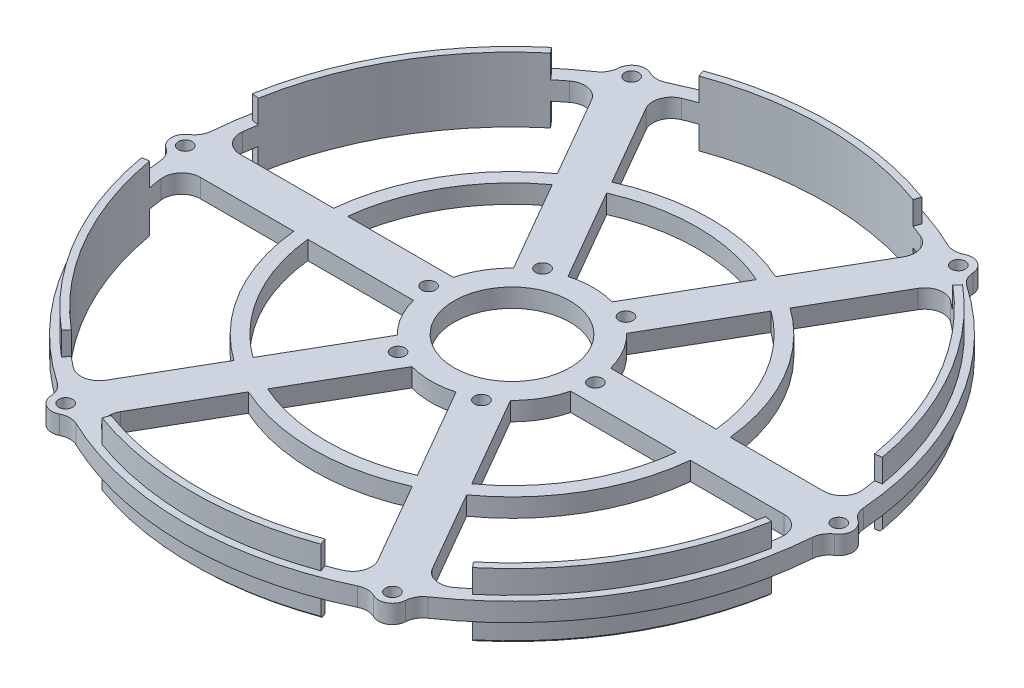
from build123d import *
from build123d.topology import SkipClean

# Parameters (mm, degrees)
SKETCH_1_R           = 1.4999999999999996
SKETCH_1_R_2         = 1.4999999999999998
SKETCH_1_R_3         = 1.5
SKETCH_1_R_4         = 1.4999999999999993
SKETCH_1_R_5         = 1.4999999999999971
SKETCH_1_R_6         = 1.5000000000000007
SKETCH_1_R_7         = 1.4999999999999944
SKETCH_1_R_8         = 1.4999999999999918
SKETCH_1_R_9         = 1.4999999999999887
SKETCH_1_R_10        = 4.5
EXTRUDE_1_DEPTH      = 4
FILLET_1_R           = 4
FILLET_2_R           = 4
EXTRUDE_2_DEPTH      = 5
EXTRUDE_2_DEPTH_BACK = 9
CHAMFER_1_SIZE       = 0.5
SKETCH_3_R           = 43
SKETCH_3_R_2         = 40
EXTRUDE_3_DEPTH      = 4
SKETCH_4_R           = 12.5
CUT_EXTRUDE_1_DEPTH  = 10
SKETCH_5_R           = 17.500000000000004
SKETCH_5_R_2         = 12.5
EXTRUDE_4_DEPTH      = 4
SKETCH_6_R           = 1.4999999999999987
SKETCH_6_R_2         = 1.4999999999997233
SKETCH_6_R_3         = 1.500000000000449
SKETCH_6_R_4         = 1.500000000001465
SKETCH_6_R_5         = 1.5000000000018021
SKETCH_6_R_6         = 1.5000000000011438
CUT_EXTRUDE_2_DEPTH  = 9.000000000000002


with BuildPart() as part:
    # 草图1 → 凸台-拉伸1 (new body)
    with BuildSketch(Plane(origin=(0, 0, 0), x_dir=(1, 0, 0), z_dir=(0, 1, 0))):
        with BuildLine():
            ThreePointArc((-70.5, 3.000000000000008), (-73.50000000000001, 3.7e-16), (-70.5, -3.000000000000008))
            ThreePointArc((-70.5, -3.000000000000008), (-61.11004418260574, -35.281900459016875), (-37.84807621135403, -59.55479096680248))
            ThreePointArc((-37.84807621135403, -59.55479096680248), (-36.75000000000076, -63.65286717815582), (-32.65192378864741, -62.55479096680256))
            ThreePointArc((-32.65192378864741, -62.55479096680256), (-7.3209e-13, -70.56380091803446), (32.65192378864611, -62.55479096680326))
            ThreePointArc((32.65192378864611, -62.55479096680326), (36.74999999999942, -63.65286717815661), (37.848076211352776, -59.5547909668033))
            ThreePointArc((37.848076211352776, -59.5547909668033), (61.110044182605264, -35.281900459017756), (70.49999999999999, -3.0000000000005))
            ThreePointArc((70.49999999999999, -3.0000000000005), (73.50000000000001, -5.1362e-13), (70.50000000000003, 2.9999999999995155))
            ThreePointArc((70.50000000000003, 2.9999999999995155), (61.11004418260573, 35.28190045901688), (37.84807621135361, 59.55479096680278))
            ThreePointArc((37.84807621135361, 59.55479096680278), (36.75000000000032, 63.65286717815611), (32.65192378864698, 62.55479096680282))
            ThreePointArc((32.65192378864698, 62.55479096680282), (2.3935e-13, 70.5638009180345), (-32.65192378864655, 62.55479096680301))
            ThreePointArc((-32.65192378864655, 62.55479096680301), (-36.74999999999988, 63.65286717815634), (-37.84807621135321, 59.55479096680301))
            ThreePointArc((-37.84807621135321, 59.55479096680301), (-61.110044182605506, 35.281900459017315), (-70.5, 3.000000000000008))
        make_face()
        with Locations(Location((-8, 0, 0), (0, 0, 270))):
            Circle(SKETCH_1_R, mode=Mode.SUBTRACT)
        with Locations(Location((2.793e-14, 8, 0), (0, 0, 270))):
            Circle(SKETCH_1_R_2, mode=Mode.SUBTRACT)
        with Locations(Location((8, -5.586e-14, 0), (0, 0, 270))):
            Circle(SKETCH_1_R_3, mode=Mode.SUBTRACT)
        with Locations(Location((-8.38e-14, -7.999999999999998, 0), (0, 0, 270))):
            Circle(SKETCH_1_R_4, mode=Mode.SUBTRACT)
        with Locations(Location((-70.5, 0, 0), (0, 0, 270))):
            Circle(SKETCH_1_R_5, mode=Mode.SUBTRACT)
        with Locations(Location((-35.24999999999988, 61.05479096680301, 0), (0, 0, 270))):
            Circle(SKETCH_1_R_5, mode=Mode.SUBTRACT)
        with Locations(Location((35.2500000000003, 61.0547909668028, 0), (0, 0, 270))):
            Circle(SKETCH_1_R_6, mode=Mode.SUBTRACT)
        with Locations(Location((70.5, -4.923e-13, 0), (0, 0, 270))):
            Circle(SKETCH_1_R_7, mode=Mode.SUBTRACT)
        with Locations(Location((35.24999999999944, -61.05479096680328, 0), (0, 0, 270))):
            Circle(SKETCH_1_R_8, mode=Mode.SUBTRACT)
        with Locations(Location((-35.25000000000072, -61.054790966802514, 0), (0, 0, 270))):
            Circle(SKETCH_1_R_9, mode=Mode.SUBTRACT)
        with Locations(Location((0, 0, 0), (0, 0, 270))):
            Circle(SKETCH_1_R_10, mode=Mode.SUBTRACT)
        with BuildLine():
            Line((9.579036496304996, 4.300239505243507), (67.36288251105015, 4.300239505243303))
            ThreePointArc((67.36288251105015, 4.300239505243303), (58.45671475544981, 33.74999999999966), (37.40555790942386, 56.187847774093825))
            Line((37.40555790942386, 56.187847774093825), (8.513634902050875, 6.145569196956556))
            ThreePointArc((8.513634902050875, 6.145569196956556), (9.093266739736636, 5.249999999999946), (9.579036496304996, 4.300239505243507))
        make_face(mode=Mode.SUBTRACT)
        with BuildLine():
            Line((8.513634902050788, -6.145569196956676), (37.405557909423074, -56.18784777409434))
            ThreePointArc((37.405557909423074, -56.18784777409434), (58.45671475544934, -33.7500000000005), (67.36288251105009, -4.300239505244269))
            Line((67.36288251105009, -4.300239505244269), (9.579036496304743, -4.3002395052440665))
            ThreePointArc((9.579036496304743, -4.3002395052440665), (9.093266739736448, -5.250000000000277), (8.513634902050788, -6.145569196956676))
        make_face(mode=Mode.SUBTRACT)
        with BuildLine():
            Line((-37.405557909423486, 56.187847774094074), (-8.513634902051102, 6.145569196956236))
            ThreePointArc((-8.513634902051102, 6.145569196956236), (-9.093266739736535, 5.250000000000124), (-9.579036496304667, 4.3002395052442415))
            Line((-9.579036496304667, 4.3002395052442415), (-67.36288251105003, 4.300239505244943))
            ThreePointArc((-67.36288251105003, 4.300239505244943), (-58.45671475544931, 33.75000000000055), (-37.405557909423486, 56.187847774094074))
        make_face(mode=Mode.SUBTRACT)
        with BuildLine():
            Line((-1.0654015942542432, -10.44580870220016), (-29.957324601627235, -60.48808727933743))
            ThreePointArc((-29.957324601627235, -60.48808727933743), (-7.1529e-13, -67.50000000000001), (29.957324601625945, -60.48808727933805))
            Line((29.957324601625945, -60.48808727933805), (1.0654015942535602, -10.445808702200226))
            ThreePointArc((1.0654015942535602, -10.445808702200226), (-3.4441e-13, -10.500000000000004), (-1.0654015942542432, -10.44580870220016))
        make_face(mode=Mode.SUBTRACT)
        with BuildLine():
            Line((29.957324601626794, 60.48808727933765), (1.065401594253708, 10.445808702200214))
            ThreePointArc((1.065401594253708, 10.445808702200214), (-1.952e-13, 10.500000000000004), (-1.065401594254097, 10.44580870220017))
            Line((-1.065401594254097, 10.44580870220017), (-29.957324601626386, 60.48808727933784))
            ThreePointArc((-29.957324601626386, 60.48808727933784), (2.1397e-13, 67.50000000000003), (29.957324601626794, 60.48808727933765))
        make_face(mode=Mode.SUBTRACT)
        with BuildLine():
            Line((-9.579036496304774, -4.300239505243998), (-67.36288251105012, -4.300239505243795))
            ThreePointArc((-67.36288251105012, -4.300239505243795), (-58.45671475544982, -33.749999999999666), (-37.405557909424274, -56.18784777409356))
            Line((-37.405557909424274, -56.18784777409356), (-8.513634902051185, -6.145569196956118))
            ThreePointArc((-8.513634902051185, -6.145569196956118), (-9.093266739736634, -5.249999999999946), (-9.579036496304774, -4.300239505243998))
        make_face(mode=Mode.SUBTRACT)
    extrude(amount=EXTRUDE_1_DEPTH)

    # 圆角1
    fillet_1_edges = [part.edges().sort_by_distance(p)[0] for p in [
        (-32.651923788646556, 2, -62.554790966803),
        (32.65192378864698, 2, -62.55479096680281),
        (37.848076211353614, 2, -59.55479096680278),
        (70.50000000000003, 2, -2.9999999999995124),
        (70.49999999999997, 2, 3.000000000000502),
        (37.848076211352776, 2, 59.554790966803296),
        (32.651923788646116, 2, 62.55479096680326),
        (-32.65192378864741, 2, 62.55479096680256),
        (-37.84807621135403, 2, 59.55479096680247),
        (-70.5, 2, 3.0000000000000093),
        (-70.50000000000001, 2, -3.000000000000006),
        (-37.84807621135322, 2, -59.55479096680301),
        (29.957324601625942, 2, 60.488087279338046),
        (-29.957324601627235, 2, 60.488087279337435),
        (67.36288251105009, 2, 4.30023950524427),
        (37.40555790942307, 2, 56.18784777409434),
        (37.40555790942386, 2, -56.187847774093825),
        (67.36288251105015, 2, -4.300239505243303),
        (-29.957324601626386, 2, -60.48808727933785),
        (29.957324601626794, 2, -60.488087279337655),
        (-67.36288251105003, 2, -4.300239505244943),
        (-37.40555790942349, 2, -56.18784777409407),
        (-67.36288251105012, 2, 4.300239505243796),
        (-37.405557909424274, 2, 56.18784777409357),
    ]]
    fillet(fillet_1_edges, radius=FILLET_1_R)

    # 圆角2
    # the kernel refuses this fillet: 4 mm, written as the material it adds along each edge
    with BuildSketch(Plane(origin=(-1.0654015942542432, 0, 10.44580870220016), x_dir=(-0.5000000000000071, 0, 0.8660254037844346), z_dir=(0, 1, 0))) as fillet_2_piece_1:
        with BuildLine():
            CenterArc((2.3102874607430097, 4.000000000000001), FILLET_2_R, 214.9198731811867, 55.08012681881331)
            ThreePointArc((-0.9695260446492189, 1.710278757174414), (-0.44464689566161064, 0.8778804840632212), (0, 0))
            Line((0, 0), (2.31028746074301, 1e-17))
        make_face()
    extrude(amount=4)
    with BuildSketch(Plane(origin=(-8.513634902051187, 0, 6.145569196956119), x_dir=(-0.5068146140540679, 0, -0.8620550718957729), z_dir=(0, 1, 0))) as fillet_2_piece_2:
        with BuildLine():
            CenterArc((2.3404393067669487, 3.9824329250590425), FILLET_2_R, 209.5481152574792, 55.08012681882752)
            Line((-1.1393281601452958, 2.0098157862763673), (0, 0))
            ThreePointArc((0, 0), (0.9829845088421205, 0.04611357172001613), (1.9659690176842453, -4e-17))
        make_face()
    extrude(amount=4)
    with BuildSketch(Plane(origin=(-9.579036496304774, 0, 4.300239505243998), x_dir=(-1, 0, -3.46e-15), z_dir=(0, 1, 0))) as fillet_2_piece_3:
        with BuildLine():
            CenterArc((2.310287460742878, 4), FILLET_2_R, 214.91987318118893, 55.08012681881104)
            ThreePointArc((-0.9695260446492592, 1.7102787571742841), (-0.44464689566163024, 0.877880484063158), (0, 0))
            Line((0, 0), (2.3102874607428774, 0))
        make_face()
    extrude(amount=4)
    with BuildSketch(Plane(origin=(-9.579036496304667, 0, -4.300239505244241), x_dir=(0.49315428469593503, 0, -0.86994186672791), z_dir=(0, 1, 0))) as fillet_2_piece_4:
        with BuildLine():
            CenterArc((2.340439306766931, 3.982432925059041), FILLET_2_R, 209.54811525747962, 55.08012681882701)
            Line((-1.1393281601452994, 2.0098157862763424), (0, 0))
            ThreePointArc((0, 0), (0.9829845088421114, 0.04611357172001763), (1.9659690176842226, 1e-16))
        make_face()
    extrude(amount=4)
    with BuildSketch(Plane(origin=(-8.513634902051102, 0, -6.145569196956236), x_dir=(-0.4999999999999958, 0, -0.866025403784441), z_dir=(0, 1, 0))) as fillet_2_piece_5:
        with BuildLine():
            CenterArc((2.310287460742879, 3.9999999999999996), FILLET_2_R, 214.91987318118888, 55.080126818811095)
            ThreePointArc((-0.9695260446492604, 1.7102787571742883), (-0.4446468956616306, 0.8778804840631608), (0, 0))
            Line((0, 0), (2.3102874607428756, 0))
        make_face()
    extrude(amount=4)
    with BuildSketch(Plane(origin=(1.0654015942537083, 0, -10.445808702200214), x_dir=(0.5000000000000073, 0, -0.8660254037844344), z_dir=(0, 1, 0))) as fillet_2_piece_6:
        with BuildLine():
            CenterArc((2.3102874607428614, 4), FILLET_2_R, 214.91987318118936, 55.08012681881064)
            ThreePointArc((-0.9695260446492604, 1.710278757174261), (-0.4446468956616301, 0.8778804840631479), (0, 0))
            Line((0, 0), (2.3102874607428623, 1e-17))
        make_face()
    extrude(amount=4)
    with BuildSketch(Plane(origin=(-1.065401594254097, 0, -10.445808702200168), x_dir=(0.9999688987499935, 0, -0.007886794832196306), z_dir=(0, 1, 0))) as fillet_2_piece_7:
        with BuildLine():
            CenterArc((2.34043930676708, 3.9824329250590376), FILLET_2_R, 209.5481152574761, 55.08012681882997)
            Line((-1.13932816014527, 2.0098157862765516), (0, 0))
            ThreePointArc((0, 0), (0.9829845088421648, 0.04611357172002539), (1.96596901768433, 0))
        make_face()
    extrude(amount=4)
    with BuildSketch(Plane(origin=(9.579036496304997, 0, -4.300239505243507), x_dir=(-0.4931542846958736, 0, -0.8699418667279448), z_dir=(0, 1, 0))) as fillet_2_piece_8:
        with BuildLine():
            CenterArc((2.340439306767078, -3.9824329250590407), FILLET_2_R, 95.37175792369351, 55.08012681882957)
            Line((-1.1393281601452454, -2.009815786276506), (0, 0))
            ThreePointArc((0, 0), (0.9829845088421809, -0.04611357172001845), (1.9659690176843594, 3e-17))
        make_face()
    extrude(amount=4)
    with BuildSketch(Plane(origin=(8.513634902050875, 0, -6.145569196956556), x_dir=(0.5000000000000061, 0, -0.866025403784435), z_dir=(0, 1, 0))) as fillet_2_piece_9:
        with BuildLine():
            CenterArc((2.310287460742994, -4.000000000000001), FILLET_2_R, 89.99999999999994, 55.08012681881351)
            ThreePointArc((-0.9695260446492374, -1.7102787571744216), (-0.4446468956616173, -0.8778804840632259), (0, 0))
            Line((0, 0), (2.310287460742998, 0))
        make_face()
    extrude(amount=4)
    with BuildSketch(Plane(origin=(9.579036496304745, 0, 4.3002395052440665), x_dir=(-0.49315428469592015, 0, 0.8699418667279183), z_dir=(0, 1, 0))) as fillet_2_piece_10:
        with BuildLine():
            CenterArc((2.3404393067669487, 3.9824329250590416), FILLET_2_R, 209.54811525747917, 55.08012681882752)
            Line((-1.1393281601452967, 2.0098157862763704), (0, 0))
            ThreePointArc((0, 0), (0.9829845088421224, 0.04611357172001689), (1.9659690176842455, -5e-17))
        make_face()
    extrude(amount=4)
    with BuildSketch(Plane(origin=(8.51363490205079, 0, 6.145569196956677), x_dir=(0.4999999999999941, 0, 0.866025403784442), z_dir=(0, 1, 0))) as fillet_2_piece_11:
        with BuildLine():
            CenterArc((2.310287460742971, 4), FILLET_2_R, 214.9198731811868, 55.080126818813255)
            ThreePointArc((-0.969526044649251, 1.7102787571744063), (-0.44464689566161575, 0.8778804840632242), (0, 0))
            Line((0, 0), (2.3102874607429755, 0))
        make_face()
    extrude(amount=4)
    with BuildSketch(Plane(origin=(1.0654015942535602, 0, 10.445808702200228), x_dir=(0.4999999999999959, 0, 0.8660254037844409), z_dir=(0, 1, 0))) as fillet_2_piece_12:
        with BuildLine():
            CenterArc((2.3102874607428734, -4), FILLET_2_R, 89.99999999999994, 55.08012681881101)
            ThreePointArc((-0.9695260446492603, -1.7102787571742772), (-0.4446468956616315, -0.8778804840631549), (0, 0))
            Line((0, 0), (2.3102874607428774, -2.2e-16))
        make_face()
    extrude(amount=4)

    # 草图2 → 凸台-拉伸2 (add, two sides: drawn at the far end of the back side and taken through both)
    with SkipClean():  # the faces are left unmerged after this step: merging them gives an invalid solid
        with BuildSketch(Plane(origin=(0, 0, 0), x_dir=(-1, 0, 0), z_dir=(0, -1, 0)).offset(-EXTRUDE_2_DEPTH_BACK)):
            with BuildLine():
                Line((23.0863596744827, -63.429251903048794), (23.5993898894712, -64.83879083422764))
                ThreePointArc((23.5993898894712, -64.83879083422764), (4.23e-15, -68.99999999999999), (-23.5993898894712, -64.83879083422764))
                Line((-23.5993898894712, -64.83879083422764), (-23.0863596744827, -63.429251903048794))
                ThreePointArc((-23.0863596744827, -63.429251903048794), (4.13e-15, -67.5), (23.0863596744827, -63.429251903048794))
            make_face()
            with BuildLine():
                Line((-43.38816365384148, -51.70799991053096), (-44.352345068371285, -52.85706657520941))
                ThreePointArc((-44.352345068371285, -52.85706657520941), (-59.75575286112633, -34.49999999999986), (-67.95173495784238, -11.981724259017966))
                Line((-67.95173495784238, -11.981724259017966), (-66.4745233283241, -11.721251992517583))
                ThreePointArc((-66.4745233283241, -11.721251992517583), (-58.4567147554497, -33.74999999999988), (-43.38816365384148, -51.70799991053096))
            make_face()
            with BuildLine():
                Line((-66.47452332832401, 11.721251992518056), (-67.9517349578423, 11.981724259018446))
                ThreePointArc((-67.9517349578423, 11.981724259018446), (-59.755752861126105, 34.50000000000029), (-44.352345068370916, 52.857066575209736))
                Line((-44.352345068370916, 52.857066575209736), (-43.388163653841126, 51.70799991053128))
                ThreePointArc((-43.388163653841126, 51.70799991053128), (-58.45671475544946, 33.75000000000029), (-66.47452332832401, 11.721251992518056))
            make_face()
            with BuildLine():
                Line((-23.086359674482257, 63.429251903048964), (-23.599389889470746, 64.83879083422781))
                ThreePointArc((-23.599389889470746, 64.83879083422781), (4.945e-13, 68.99999999999997), (23.599389889471656, 64.83879083422747))
                Line((23.599389889471656, 64.83879083422747), (23.086359674483145, 63.42925190304863))
                ThreePointArc((23.086359674483145, 63.42925190304863), (4.6876e-13, 67.5), (-23.086359674482257, 63.429251903048964))
            make_face()
            with BuildLine():
                Line((43.388163653841836, 51.70799991053065), (44.35234506837164, 52.8570665752091))
                ThreePointArc((44.35234506837164, 52.8570665752091), (59.755752861126574, 34.49999999999944), (67.95173495784246, 11.981724259017493))
                Line((67.95173495784246, 11.981724259017493), (66.47452332832417, 11.721251992517116))
                ThreePointArc((66.47452332832417, 11.721251992517116), (58.45671475544992, 33.74999999999946), (43.388163653841836, 51.70799991053065))
            make_face()
            with BuildLine():
                Line((66.47452332832391, -11.721251992518493), (67.9517349578422, -11.981724259018899))
                ThreePointArc((67.9517349578422, -11.981724259018899), (59.75575286112585, -34.500000000000675), (44.35234506837053, -52.85706657521001))
                Line((44.35234506837053, -52.85706657521001), (43.388163653840756, -51.70799991053155))
                ThreePointArc((43.388163653840756, -51.70799991053155), (58.45671475544921, -33.75000000000066), (66.47452332832391, -11.721251992518493))
            make_face()
        extrude(amount=EXTRUDE_2_DEPTH + EXTRUDE_2_DEPTH_BACK)

    # 倒角1
    chamfer_1_edges = [part.edges().sort_by_distance(p)[0] for p in [
        (7.11e-15, -5, 68.99999999999997),
        (59.75575286112634, -5, 34.49999999999986),
        (59.755752861126126, -5, -34.5000000000003),
        (-4.8939e-13, -5, -68.99999999999997),
        (-59.75575286112658, -5, -34.49999999999944),
        (-59.755752861125856, -5, 34.50000000000067),
    ]]
    chamfer(chamfer_1_edges, length=CHAMFER_1_SIZE)

    # 草图3 → 凸台-拉伸3 (add)
    with SkipClean():  # the faces are left unmerged after this step: merging them gives an invalid solid
        with BuildSketch(Plane(origin=(0, 4, 0), x_dir=(1, 0, 0), z_dir=(0, 1, 0))):
            Circle(SKETCH_3_R)
            Circle(SKETCH_3_R_2, mode=Mode.SUBTRACT)
        extrude(amount=-EXTRUDE_3_DEPTH)

    # 草图4 → 切除-拉伸1 (cut)
    with SkipClean():  # the faces are left unmerged after this step: merging them gives an invalid solid
        with BuildSketch(Plane(origin=(0, 4, 0), x_dir=(1, 0, 0), z_dir=(0, 1, 0))):
            Circle(SKETCH_4_R)
        extrude(amount=-CUT_EXTRUDE_1_DEPTH, mode=Mode.SUBTRACT)

    # 草图5 → 凸台-拉伸4 (add)
    with SkipClean():  # the faces are left unmerged after this step: merging them gives an invalid solid
        with BuildSketch(Plane(origin=(0, 4, 0), x_dir=(1, 0, 0), z_dir=(0, 1, 0))):
            Circle(SKETCH_5_R)
            with Locations(Location((0, 0, 0), (0, 0, 270))):
                Circle(SKETCH_5_R_2, mode=Mode.SUBTRACT)
        extrude(amount=-EXTRUDE_4_DEPTH)

    # 草图6 → 切除-拉伸2 (cut)
    with SkipClean():  # the faces are left unmerged after this step: merging them gives an invalid solid
        with BuildSketch(Plane.XZ):
            with Locations(Location((8.999999999999854, 15.58845726811998, 0), (0, 0, 270))):
                Circle(SKETCH_6_R)
            with Locations(Location((18.000000000000888, 6.7967e-13, 0), (0, 0, 270))):
                Circle(SKETCH_6_R_2)
            with Locations(Location((9.000000000001913, -15.588457268119818, 0), (0, 0, 270))):
                Circle(SKETCH_6_R_3)
            with Locations(Location((-8.999999999998092, -15.588457268121008, 0), (0, 0, 270))):
                Circle(SKETCH_6_R_4)
            with Locations(Location((-17.999999999999126, -1.70974e-12, 0), (0, 0, 270))):
                Circle(SKETCH_6_R_5)
            with Locations(Location((-9.000000000000162, 15.588457268118784, 0), (0, 0, 270))):
                Circle(SKETCH_6_R_6)
        extrude(amount=-CUT_EXTRUDE_2_DEPTH, mode=Mode.SUBTRACT)


solid = part.part
